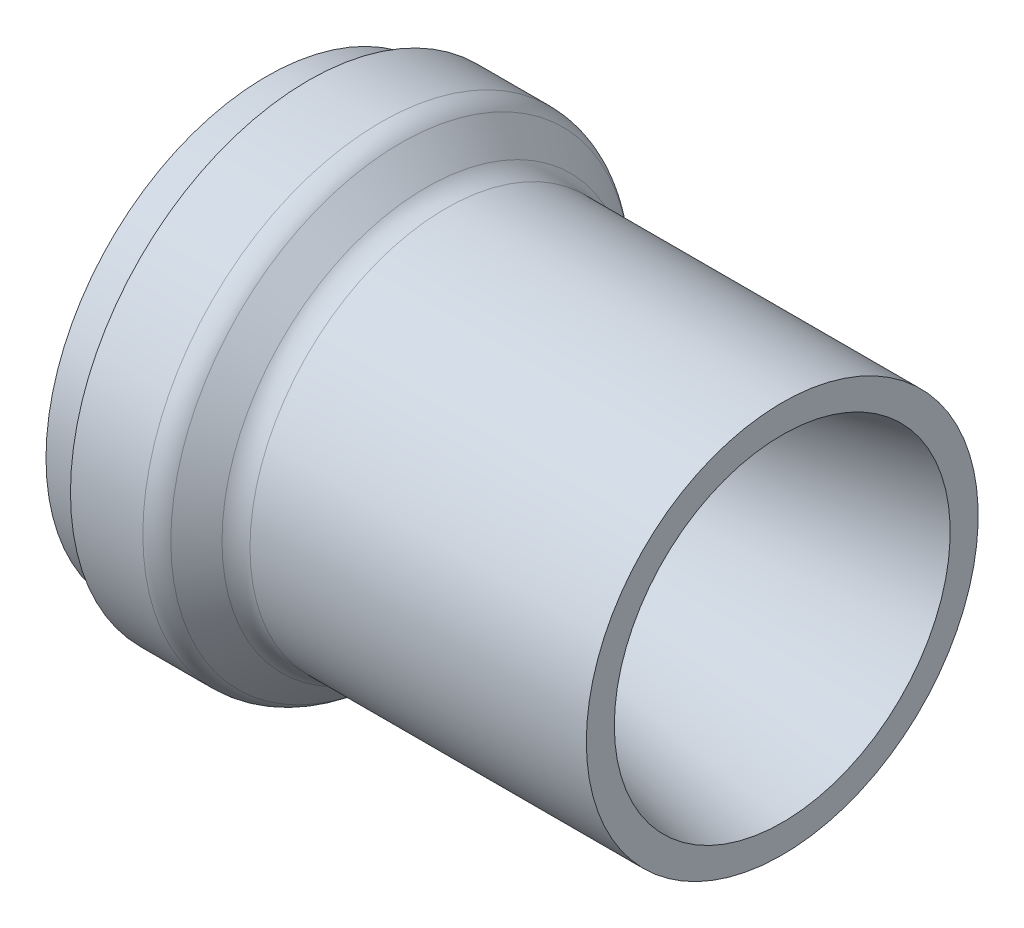
from build123d import *


with BuildPart() as part:
    # Sketch1 → Revolve1 (revolve)
    with BuildSketch(Plane.XY):
        with BuildLine():
            Line((117.030724522, 6.096), (117.030724522, 12.446))
            Line((117.030724522, 12.446), (21.432640697, 32.766))
            Line((21.432640697, 32.766), (15.082640697, 32.766))
            Line((15.082640697, 32.766), (0, 6.6421))
            Line((0, 6.6421), (0, 0.5461))
            Line((0, 0.5461), (9.525, 0.5461))
            Line((9.525, 0.5461), (9.525, -3.429))
            Line((9.525, -3.429), (25.944743879, -3.429))
            ThreePointArc((25.944743879, -3.429), (28.374783674, -2.945635031), (30.434871939, -1.569128061))
            Line((30.434871939, -1.569128061), (36.240128061, 4.236128061))
            ThreePointArc((36.240128061, 4.236128061), (38.300216326, 5.612635031), (40.730256121, 6.096))
            Line((40.730256121, 6.096), (117.030724522, 6.096))
        make_face()
    revolve(axis=Axis((0, 50.546, 0), (1, 0, 0)))


solid = part.part
